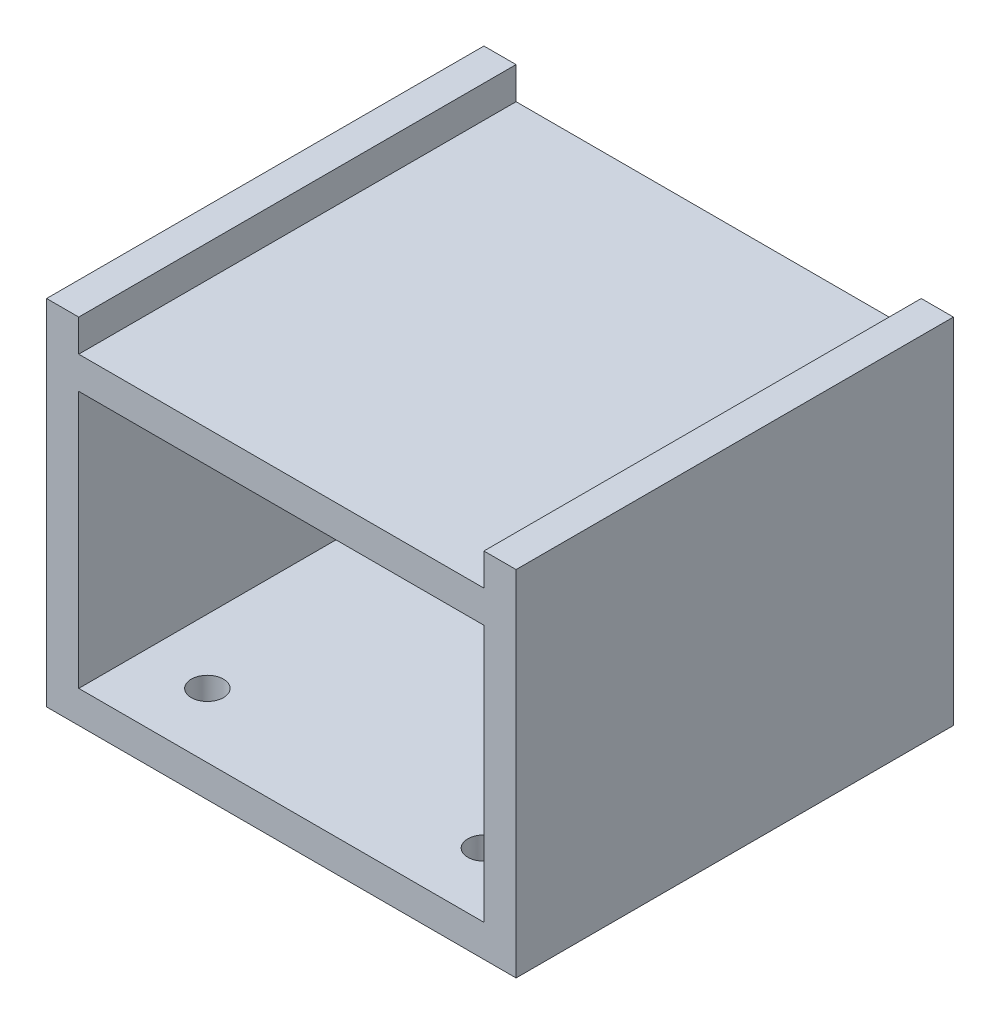
from build123d import *

# Parameters (mm, degrees)
SKETCH1_W               = 86.36
SKETCH1_H               = 63.5
BOSS_EXTRUDE1_DEPTH     = 92.71
SKETCH2_W               = 6.35
SKETCH2_H               = 86.36
BOSS_EXTRUDE2_DEPTH     = 6.35
CUT_EXTRUDE2_DEPTH      = 110.138748848
CUT_EXTRUDE2_DEPTH_BACK = 110.138748848
SKETCH4_W               = 80.01
SKETCH4_H               = 50.8
SKETCH5_R               = 3.175
CUT_EXTRUDE3_DEPTH      = 121.382334668


with BuildPart() as part:
    # Sketch1 → Boss-Extrude1 (new body)
    with BuildSketch(Plane(origin=(0, 0, 0), x_dir=(0, 0, -1), z_dir=(1, 0, 0))):
        Rectangle(SKETCH1_W, SKETCH1_H)
    extrude(amount=BOSS_EXTRUDE1_DEPTH)

    # Sketch2 → Boss-Extrude2 (add)
    with BuildSketch(Plane(origin=(0, 31.75, 0), x_dir=(1, 0, 0), z_dir=(0, 1, 0))):
        with Locations((89.535, 0)):
            Rectangle(SKETCH2_W, SKETCH2_H)
        with Locations((3.175, 0)):
            Rectangle(SKETCH2_W, SKETCH2_H)
    extrude(amount=BOSS_EXTRUDE2_DEPTH)

    # Sketch4 → Cut-Extrude2 (cut, two sides: drawn at the far end of the back side and taken through both)
    with BuildSketch(Plane.XY.offset(-CUT_EXTRUDE2_DEPTH_BACK)):
        with Locations((46.355, 0)):
            Rectangle(SKETCH4_W, SKETCH4_H)
    extrude(amount=CUT_EXTRUDE2_DEPTH + CUT_EXTRUDE2_DEPTH_BACK, mode=Mode.SUBTRACT)

    # Sketch5 → Cut-Extrude3 (cut, through all)
    with BuildSketch(Plane(origin=(0, -25.4, 0), x_dir=(1, 0, 0), z_dir=(0, 1, 0))):
        with Locations((19.05, 30.48)):
            Circle(SKETCH5_R)
        with Locations((73.66, 30.48)):
            Circle(SKETCH5_R)
        with Locations((73.66, -30.48)):
            Circle(SKETCH5_R)
        with Locations((19.05, -30.48)):
            Circle(SKETCH5_R)
    extrude(amount=-CUT_EXTRUDE3_DEPTH, mode=Mode.SUBTRACT)


solid = part.part
